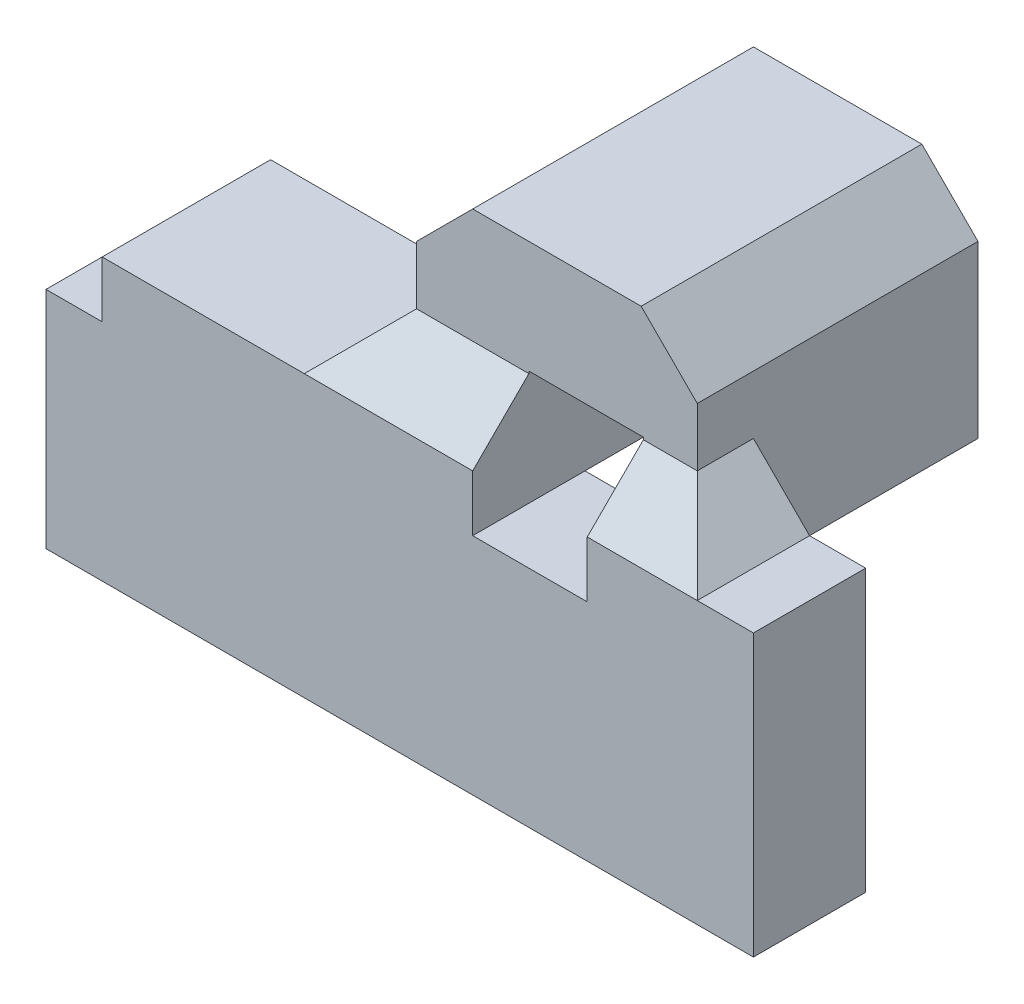
from build123d import *

# Parameters (mm, degrees)
SZKIC1_W                        = 58
SZKIC1_H                        = 20
DODANIE_WYCI_GNI_CIE1_DEPTH     = 5
SZKIC2_W                        = 15
SZKIC2_H                        = 5
DODANIE_WYCI_GNI_CIE2_DEPTH     = 58
DODANIE_WYCI_GNI_CIE3_DEPTH     = 20
DODANIE_WYCI_GNI_CIE4_DEPTH     = 10
WYTNIJ_WYCI_GNI_CIE2_DEPTH      = 47.562216442
WYTNIJ_WYCI_GNI_CIE2_DEPTH_BACK = 47.562216442
SZKIC6_W                        = 58
SZKIC6_H                        = 5
DODANIE_WYCI_GNI_CIE5_DEPTH     = 20
SZKIC7_R                        = 2
WYTNIJ_WYCI_GNI_CIE3_DEPTH      = 10
DODANIE_WYCI_GNI_CIE8_DEPTH     = 10
SZKIC11_W                       = 10.2
SZKIC11_H                       = 10.2
DODANIE_WYCI_GNI_CIE9_DEPTH     = 5
SFAZOWANIE2_SIZE                = 5
SFAZOWANIE3_SIZE                = 5
SZKIC12_W                       = 10
SZKIC12_H                       = 20
WYTNIJ_WYCI_GNI_CIE4_DEPTH      = 10


with BuildPart() as part:
    # Szkic1 → Dodanie-wyciągnięcie1 (new body)
    with BuildSketch(Plane.XY):
        Rectangle(SZKIC1_W, SZKIC1_H)
    extrude(amount=DODANIE_WYCI_GNI_CIE1_DEPTH)

    # Szkic2 → Dodanie-wyciągnięcie2 (add)
    with BuildSketch(Plane(origin=(29, 0, 0), x_dir=(0, 0, -1), z_dir=(1, 0, 0))):
        with Locations((-2.5, 12.5)):
            Rectangle(SZKIC2_W, SZKIC2_H)
    extrude(amount=-DODANIE_WYCI_GNI_CIE2_DEPTH)

    # Szkic3 → Dodanie-wyciągnięcie3 (add)
    with BuildSketch(Plane.XZ.offset(10)):
        Polygon((-34, 5), (-29, 0), (-29, 5), (-24, 5), (-29, 10), (-34, 10), align=None)
    extrude(amount=-DODANIE_WYCI_GNI_CIE3_DEPTH)

    # Szkic5 → Dodanie-wyciągnięcie4 (add)
    with BuildSketch(Plane.XY.offset(5)):
        Polygon((14.2, 20.2), (14.2, 10), (19, 10), (19, 30.2), (-6, 30.2), (-6, 10), (4, 10), (4, 20.2), align=None)
    extrude(amount=-DODANIE_WYCI_GNI_CIE4_DEPTH)

    # Szkic5<3> → Wytnij-wyciągnięcie2 (cut, two sides: drawn at the far end of the back side and taken through both)
    with BuildSketch(Plane.XY.offset(5).offset(-WYTNIJ_WYCI_GNI_CIE2_DEPTH_BACK)):
        Polygon((4, 10), (14.2, 10), (14.2, 15), (14.2, 20.2), (4, 20.2), (4, 15), align=None)
    extrude(amount=WYTNIJ_WYCI_GNI_CIE2_DEPTH + WYTNIJ_WYCI_GNI_CIE2_DEPTH_BACK, mode=Mode.SUBTRACT)

    # Szkic6 → Dodanie-wyciągnięcie5 (add)
    with BuildSketch(Plane(origin=(0, 10, 0), x_dir=(1, 0, 0), z_dir=(0, 1, 0))):
        with Locations((0, -7.5)):
            Rectangle(SZKIC6_W, SZKIC6_H)
    extrude(amount=-DODANIE_WYCI_GNI_CIE5_DEPTH)

    # Szkic7 → Wytnij-wyciągnięcie3 (cut)
    with BuildSketch(Plane.XZ.offset(10)):
        with Locations(Location((-19, 5, 0), (0, 0, 270))):
            Circle(SZKIC7_R)
        with Locations(Location((11, 5, 0), (0, 0, 270))):
            Circle(SZKIC7_R)
    extrude(amount=-WYTNIJ_WYCI_GNI_CIE3_DEPTH, mode=Mode.SUBTRACT)

    # Szkic10 → Dodanie-wyciągnięcie8 (add)
    with BuildSketch(Plane(origin=(0, 0, -5), x_dir=(-1, 0, 0), z_dir=(0, 0, -1))):
        Polygon((6, 10), (6, 15), (6, 30.2), (-19, 30.2), (-19, 15), (-29, 15), (-29, 10), (-14.2, 10), (-14.2, 20.2), (-4, 20.2), (-4, 10), align=None)
    extrude(amount=DODANIE_WYCI_GNI_CIE8_DEPTH)

    # Szkic11 → Dodanie-wyciągnięcie9 (add)
    with BuildSketch(Plane(origin=(0, 0, -15), x_dir=(-1, 0, 0), z_dir=(0, 0, -1))):
        with Locations((-9.1, 15.1)):
            Rectangle(SZKIC11_W, SZKIC11_H)
        Polygon((-29, 10), (-14.2, 10), (-14.2, 20.2), (-4, 20.2), (-4, 10), (6, 10), (6, 30.2), (-19, 30.2), (-19, 15), (-29, 15), align=None)
    extrude(amount=DODANIE_WYCI_GNI_CIE9_DEPTH)

    # Sfazowanie2
    sfazowanie2_edges = [part.edges().sort_by_distance(p)[0] for p in [
        (-6, 30.2, -7.5),
        (19, 30.2, -7.5),
    ]]
    chamfer(sfazowanie2_edges, length=SFAZOWANIE2_SIZE)

    # Sfazowanie3
    # the kernel refuses this chamfer: 5 mm, written as the material it adds along each edge
    with BuildSketch(Plane(origin=(1.34158506, 15, 5), x_dir=(0, 0.9996219169112968, -0.027495876610586317), z_dir=(1, 0, 0))) as sfazowanie3_piece_1_section:
        Polygon((SFAZOWANIE3_SIZE * 0.999621916911, SFAZOWANIE3_SIZE * 0.0274958766106), (-SFAZOWANIE3_SIZE * 0.0274958766106, SFAZOWANIE3_SIZE * 0.999621916911), (0, 0), align=None)
    sfazowanie3_piece_1 = extrude(amount=17.65841494, mode=Mode.PRIVATE)
    sfazowanie3_piece_1 = split(sfazowanie3_piece_1, bisect_by=Plane(origin=(4, 16.652020772, 6.643171669), z_dir=(-1, 0, 0)), keep=Keep.TOP, mode=Mode.PRIVATE)
    sfazowanie3_piece_1 = split(sfazowanie3_piece_1, bisect_by=Plane(origin=(2.67079253, 16.652020772, 10), z_dir=(0, 0, -1)), keep=Keep.TOP, mode=Mode.PRIVATE)
    add(sfazowanie3_piece_1)
    with BuildSketch(Plane(origin=(14.2, 15, 5), x_dir=(0, 0.9996219169112968, -0.027495876610586317), z_dir=(1, 0, 0))) as sfazowanie3_piece_2_section:
        Polygon((SFAZOWANIE3_SIZE * 0.999621916911, SFAZOWANIE3_SIZE * 0.0274958766106), (-SFAZOWANIE3_SIZE * 0.0274958766106, SFAZOWANIE3_SIZE * 0.999621916911), (0, 0), align=None)
    sfazowanie3_piece_2 = extrude(amount=4.8, mode=Mode.PRIVATE)
    sfazowanie3_piece_2 = split(sfazowanie3_piece_2, bisect_by=Plane(origin=(16.6, 16.652020772, 10), z_dir=(0, 0, -1)), keep=Keep.TOP, mode=Mode.PRIVATE)
    add(sfazowanie3_piece_2)
    with BuildSketch(Plane(origin=(-6, 15, 5), x_dir=(0, 0.9996219169112968, -0.027495876610586317), z_dir=(1, 0, 0))) as sfazowanie3_piece_3_section:
        Polygon((SFAZOWANIE3_SIZE * 0.999621916911, SFAZOWANIE3_SIZE * 0.0274958766106), (-SFAZOWANIE3_SIZE * 0.0274958766106, SFAZOWANIE3_SIZE * 0.999621916911), (0, 0), align=None)
    sfazowanie3_piece_3 = extrude(amount=10, mode=Mode.PRIVATE)
    sfazowanie3_piece_3 = split(sfazowanie3_piece_3, bisect_by=Plane(origin=(-1, 16.652020772, 10), z_dir=(0, 0, -1)), keep=Keep.TOP, mode=Mode.PRIVATE)
    add(sfazowanie3_piece_3)
    with BuildSketch(Plane(origin=(-6, 15, 5), x_dir=(0, 0.9996219169112968, -0.027495876610586317), z_dir=(1, 0, 0))) as sfazowanie3_piece_4_section:
        Polygon((SFAZOWANIE3_SIZE * 0.999621916911, SFAZOWANIE3_SIZE * 0.0274958766106), (-SFAZOWANIE3_SIZE * 0.0274958766106, SFAZOWANIE3_SIZE * 0.999621916911), (0, 0), align=None)
    sfazowanie3_piece_4 = extrude(amount=22.85841494, mode=Mode.PRIVATE)
    sfazowanie3_piece_4 = split(sfazowanie3_piece_4, bisect_by=Plane(origin=(14.2, 16.652020772, 6.643171669), z_dir=(1, 0, 0)), keep=Keep.TOP, mode=Mode.PRIVATE)
    sfazowanie3_piece_4 = split(sfazowanie3_piece_4, bisect_by=Plane(origin=(15.52920747, 16.652020772, 10), z_dir=(0, 0, -1)), keep=Keep.TOP, mode=Mode.PRIVATE)
    add(sfazowanie3_piece_4)
    with BuildSketch(Plane(origin=(-6, 15, -5), x_dir=(0.027495876610586837, 0.9996219169112968, 0), z_dir=(0, 0, 1))) as sfazowanie3_piece_5:
        Polygon((SFAZOWANIE3_SIZE * 0.999621916911, SFAZOWANIE3_SIZE * 0.0274958766106), (-SFAZOWANIE3_SIZE * 0.0274958766106, SFAZOWANIE3_SIZE * 0.999621916911), (0, 0), align=None)
    extrude(amount=10)
    with BuildSketch(Plane(origin=(19, 15, -20), x_dir=(0.9996219169112968, -0.027495876610586664, 0), z_dir=(0, 0, 1))) as sfazowanie3_piece_6:
        Polygon((SFAZOWANIE3_SIZE * 0.999621916911, SFAZOWANIE3_SIZE * 0.0274958766106), (-SFAZOWANIE3_SIZE * 0.0274958766106, SFAZOWANIE3_SIZE * 0.999621916911), (0, 0), align=None)
    extrude(amount=25)
    with BuildSketch(Plane(origin=(14.2, 15, 5), x_dir=(0, 0.9996219169112968, -0.027495876610586317), z_dir=(1, 0, 0))) as sfazowanie3_piece_7a_section:
        Polygon((SFAZOWANIE3_SIZE * 0.999621916911, SFAZOWANIE3_SIZE * 0.0274958766106), (-SFAZOWANIE3_SIZE * 0.0274958766106, SFAZOWANIE3_SIZE * 0.999621916911), (0, 0), align=None)
    sfazowanie3_piece_7a = extrude(amount=17.65841494, mode=Mode.PRIVATE)
    sfazowanie3_piece_7a = split(sfazowanie3_piece_7a, bisect_by=Plane(origin=(19, 16.652020772, 6.643171669), z_dir=(1, 0, 0)), keep=Keep.TOP, mode=Mode.PRIVATE)
    sfazowanie3_piece_7a = split(sfazowanie3_piece_7a, bisect_by=Plane(origin=(24, 16.652020772, 10), z_dir=(0, 0, -1)), keep=Keep.TOP, mode=Mode.PRIVATE)
    sfazowanie3_piece_7a = split(sfazowanie3_piece_7a, bisect_by=Plane(origin=(29, 16.652020772, 6.643171669), z_dir=(-1, 0, 0)), keep=Keep.TOP, mode=Mode.PRIVATE)
    with BuildSketch(Plane(origin=(19, 15, -20), x_dir=(0.9996219169112968, -0.027495876610586664, 0), z_dir=(0, 0, 1))) as sfazowanie3_piece_7b_section:
        Polygon((SFAZOWANIE3_SIZE * 0.999621916911, SFAZOWANIE3_SIZE * 0.0274958766106), (-SFAZOWANIE3_SIZE * 0.0274958766106, SFAZOWANIE3_SIZE * 0.999621916911), (0, 0), align=None)
    sfazowanie3_piece_7b = extrude(amount=37.85841494, mode=Mode.PRIVATE)
    sfazowanie3_piece_7b = split(sfazowanie3_piece_7b, bisect_by=Plane(origin=(20.648968134, 16.648968134, 5), z_dir=(0, 0, 1)), keep=Keep.TOP, mode=Mode.PRIVATE)
    sfazowanie3_piece_7b = split(sfazowanie3_piece_7b, bisect_by=Plane(origin=(20.648968134, 16.648968134, 10), z_dir=(0, 0, -1)), keep=Keep.TOP, mode=Mode.PRIVATE)
    sfazowanie3_piece_7 = sfazowanie3_piece_7a & sfazowanie3_piece_7b
    add(sfazowanie3_piece_7)
    with BuildSketch(Plane(origin=(-6, 15, -5), x_dir=(0.027495876610586837, 0.9996219169112968, 0), z_dir=(0, 0, 1))) as sfazowanie3_piece_8a_section:
        Polygon((SFAZOWANIE3_SIZE * 0.999621916911, SFAZOWANIE3_SIZE * 0.0274958766106), (-SFAZOWANIE3_SIZE * 0.0274958766106, SFAZOWANIE3_SIZE * 0.999621916911), (0, 0), align=None)
    sfazowanie3_piece_8a = extrude(amount=22.85841494, mode=Mode.PRIVATE)
    sfazowanie3_piece_8a = split(sfazowanie3_piece_8a, bisect_by=Plane(origin=(-7.648968134, 16.648968134, 5), z_dir=(0, 0, 1)), keep=Keep.TOP, mode=Mode.PRIVATE)
    sfazowanie3_piece_8a = split(sfazowanie3_piece_8a, bisect_by=Plane(origin=(-7.648968134, 16.648968134, 10), z_dir=(0, 0, -1)), keep=Keep.TOP, mode=Mode.PRIVATE)
    with BuildSketch(Plane(origin=(-18.85841494, 15, 5), x_dir=(0, 0.9996219169112968, -0.027495876610586317), z_dir=(1, 0, 0))) as sfazowanie3_piece_8b_section:
        Polygon((SFAZOWANIE3_SIZE * 0.999621916911, SFAZOWANIE3_SIZE * 0.0274958766106), (-SFAZOWANIE3_SIZE * 0.0274958766106, SFAZOWANIE3_SIZE * 0.999621916911), (0, 0), align=None)
    sfazowanie3_piece_8b = extrude(amount=22.85841494, mode=Mode.PRIVATE)
    sfazowanie3_piece_8b = split(sfazowanie3_piece_8b, bisect_by=Plane(origin=(-6, 16.652020772, 6.643171669), z_dir=(-1, 0, 0)), keep=Keep.TOP, mode=Mode.PRIVATE)
    sfazowanie3_piece_8b = split(sfazowanie3_piece_8b, bisect_by=Plane(origin=(-12.42920747, 16.652020772, 10), z_dir=(0, 0, -1)), keep=Keep.TOP, mode=Mode.PRIVATE)
    sfazowanie3_piece_8 = sfazowanie3_piece_8a & sfazowanie3_piece_8b
    add(sfazowanie3_piece_8)

    # Szkic12 → Wytnij-wyciągnięcie4 (cut)
    with BuildSketch(Plane.XZ.offset(-10)):
        with Locations((24, -10)):
            Rectangle(SZKIC12_W, SZKIC12_H)
    extrude(amount=-WYTNIJ_WYCI_GNI_CIE4_DEPTH, mode=Mode.SUBTRACT)


solid = part.part
